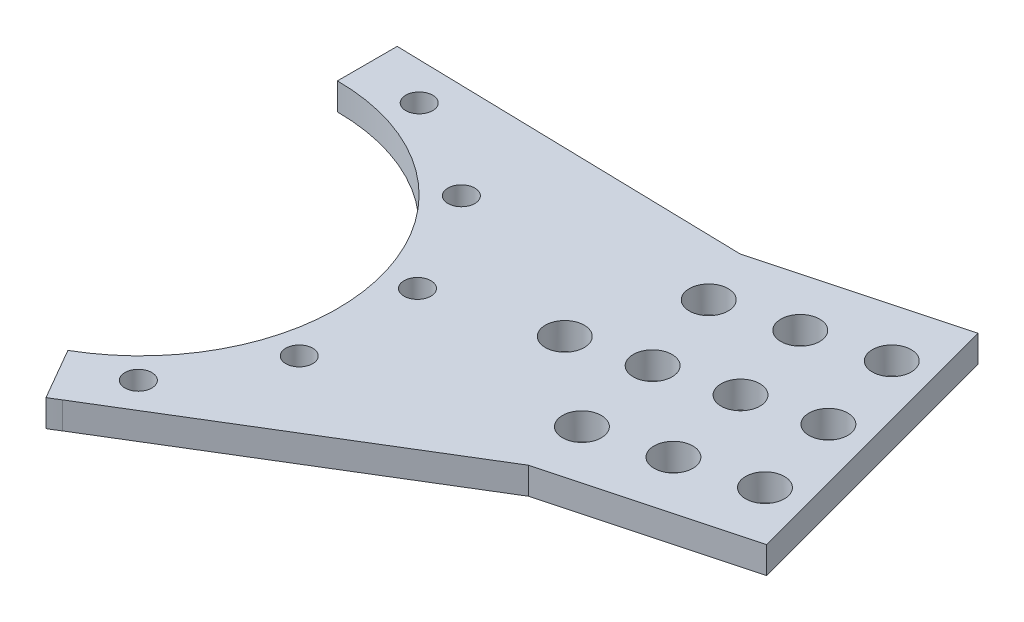
from build123d import *

# Parameters (mm, degrees)
BOSS_EXTRUDE1_DEPTH             = 2.25
BOSS_EXTRUDE2_DEPTH             = 2.25
BOSS_EXTRUDE3_DEPTH             = 2.25
SKETCH2_R                       = 2.25
CUT_EXTRUDE1_DEPTH              = 115.652736557
CIRPATTERN1_COUNT               = 3
CIRPATTERN1_ANGLE               = 60
CIRPATTERN1_THE_OTHER_WAY_COUNT = 3
CIRPATTERN1_THE_OTHER_WAY_ANGLE = 60
SKETCH6_R                       = 3.25
CUT_EXTRUDE2_DEPTH              = 115.652736557
LPATTERN1_COUNT                 = 3
LPATTERN1_PITCH                 = 12.5
SKETCH7_R                       = 3.25
CUT_EXTRUDE3_DEPTH              = 10
LPATTERN2_COUNT                 = 4
LPATTERN2_PITCH                 = 12


with BuildPart() as part:
    # Sketch1 → Boss-Extrude1 (new, symmetric)
    with BuildSketch(Plane(origin=(0, 0, 0), x_dir=(1, 0, 0), z_dir=(0, 1, 0))):
        with BuildLine():
            Line((0, 33), (0, 43))
            ThreePointArc((0, 43), (41.53481053, 11.129218939), (21.5, -37.239092363))
            Line((21.5, -37.239092363), (16.5, -28.578838325))
            ThreePointArc((16.5, -28.578838325), (31.875552268, 8.541028488), (0, 33))
        make_face()
    extrude(amount=BOSS_EXTRUDE1_DEPTH, both=True)

    # Sketch4 → Boss-Extrude2 (add, symmetric)
    with BuildSketch(Plane(origin=(0, 0, 0), x_dir=(1, 0, 0), z_dir=(0, 1, 0))):
        Polygon((90.122106501, 50.030050167), (25.40507614, 32.689174146), (38.346028395, -15.607117169), (103.063058756, 1.733758853), align=None)
    extrude(amount=BOSS_EXTRUDE2_DEPTH, both=True)

    # Sketch5 → Boss-Extrude3 (add, symmetric)
    with BuildSketch(Plane(origin=(0, 0, 0), x_dir=(1, 0, 0), z_dir=(0, 1, 0))):
        Polygon((0, 43), (58.722616268, 41.616582117), (27.323126035, 33.203114066), align=None)
        Polygon((71.663568523, -6.679709198), (40.26407829, -15.093177248), (21.5, -37.239092363), align=None)
    extrude(amount=BOSS_EXTRUDE3_DEPTH, both=True)

    # Sketch2 → Cut-Extrude1 (cut, symmetric)
    with BuildSketch(Plane(origin=(0, 2.25, 0), x_dir=(1, 0, 0), z_dir=(0, 1, 0))):
        with Locations((36.757261811, 9.638656763)):
            Circle(SKETCH2_R)
    cut_extrude1 = extrude(amount=CUT_EXTRUDE1_DEPTH, both=True, mode=Mode.SUBTRACT)

    # CirPattern1: Cut-Extrude1 ×3 about axis
    cirpattern1_axis = Axis((0, 2.25, 0), (0, -1, 0))
    for i in range(1, CIRPATTERN1_COUNT):
        add(cut_extrude1.rotate(cirpattern1_axis, i * CIRPATTERN1_ANGLE / (CIRPATTERN1_COUNT - 1)), mode=Mode.SUBTRACT)

    # CirPattern1 the other way: Cut-Extrude1 ×3 about axis
    cirpattern1_the_other_way_axis = Axis((0, 2.25, 0), (0, 1, 0))
    for i in range(1, CIRPATTERN1_THE_OTHER_WAY_COUNT):
        add(cut_extrude1.rotate(cirpattern1_the_other_way_axis, i * CIRPATTERN1_THE_OTHER_WAY_ANGLE / (CIRPATTERN1_THE_OTHER_WAY_COUNT - 1)), mode=Mode.SUBTRACT)

    # Sketch6 → Cut-Extrude2 (cut, symmetric)
    with BuildSketch(Plane(origin=(0, 2.25, 0), x_dir=(1, 0, 0), z_dir=(0, 1, 0))):
        with Locations((94.679313348, 9.840102845)):
            Circle(SKETCH6_R)
        with Locations((86.914741995, 38.817877634)):
            Circle(SKETCH6_R)
    cut_extrude2 = extrude(amount=CUT_EXTRUDE2_DEPTH, both=True, mode=Mode.SUBTRACT)

    # LPattern1: Cut-Extrude2 ×3
    with Locations(*[Vector(-0.9659258262890655, 0, 0.25881904510253145) * (i * LPATTERN1_PITCH) for i in range(1, LPATTERN1_COUNT)]):
        add(cut_extrude2, mode=Mode.SUBTRACT)

    # Sketch7 → Cut-Extrude3 (cut)
    with BuildSketch(Plane(origin=(0, 2.25, 0), x_dir=(1, 0, 0), z_dir=(0, 1, 0))):
        with Locations((90.797027671, 24.32899024)):
            Circle(SKETCH7_R)
    cut_extrude3 = extrude(amount=-CUT_EXTRUDE3_DEPTH, mode=Mode.SUBTRACT)

    # LPattern2: Cut-Extrude3 ×4
    with Locations(*[Vector(-0.9659258262890655, 0, 0.25881904510253145) * (i * LPATTERN2_PITCH) for i in range(1, LPATTERN2_COUNT)]):
        add(cut_extrude3, mode=Mode.SUBTRACT)


solid = part.part
